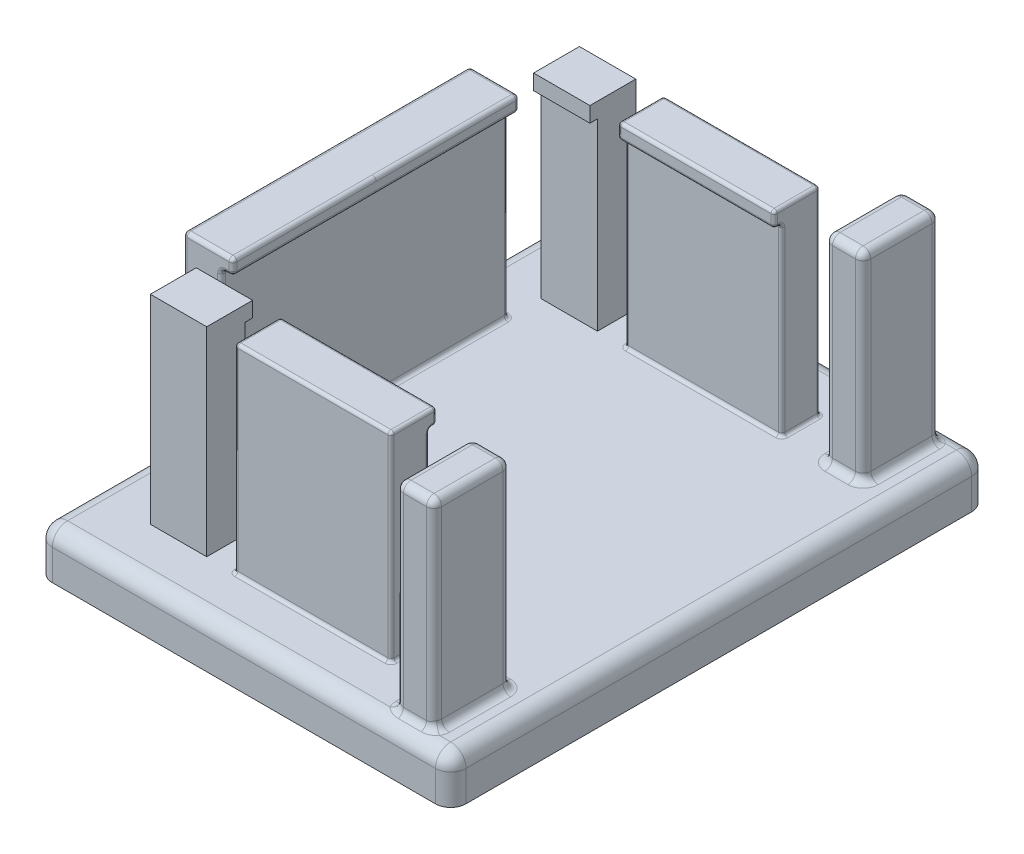
from build123d import *

# Parameters (mm, degrees)
SKETCH1_W              = 27
SKETCH1_H              = 35
BOSS_EXTRUDE1_DEPTH    = 3
FILLET1_R              = 1
FILLET2_R              = 1
FILLET3_R              = 1
FILLET4_R              = 1
SKETCH2_W              = 15.7
SKETCH2_H              = 2.5
BOSS_EXTRUDE5_DEPTH    = 13
SKETCH4_W              = 1.823720813
SKETCH4_H              = 2.5
CUT_EXTRUDE1_DEPTH     = 13
SKETCH2_7_W            = 2.5
SKETCH2_7_H            = 5
BOSS_EXTRUDE7_DEPTH    = 13
SKETCH2_8_W            = 2.5
SKETCH2_8_H            = 9.349999999
BOSS_EXTRUDE8_DEPTH    = 13
SKETCH9_W              = 9.349999999
SKETCH9_H              = 1
BOSS_EXTRUDE13_DEPTH   = 0.74200004
SKETCH8_W              = 10.2
SKETCH8_H              = 1
SKETCH8_W_2            = 3.676279187
BOSS_EXTRUDE12_DEPTH   = 0.492000032
FILLET64_R             = 0.5
FILLET65_R             = 0.2032
FILLET67_R             = 0.254
FILLET64_OF_MIRROR13_R = 0.5
FILLET65_OF_MIRROR13_R = 0.2032
FILLET67_OF_MIRROR13_R = 0.254


with BuildPart() as part:
    # Sketch1 → Boss-Extrude1 (new body)
    with BuildSketch(Plane(origin=(0, 0, 0), x_dir=(1, 0, 0), z_dir=(0, 1, 0))):
        with Locations((-49.521621622, -28.022046139)):
            Rectangle(SKETCH1_W, SKETCH1_H)
    extrude(amount=BOSS_EXTRUDE1_DEPTH)

    # Fillet1
    fillet1_edges = [part.edges().sort_by_distance(p)[0] for p in [
        (-36.021621622, 3, 28.022046139),
    ]]
    fillet(fillet1_edges, radius=FILLET1_R)

    # Fillet2
    fillet2_edges = [part.edges().sort_by_distance(p)[0] for p in [
        (-50.021621622, 3, 10.522046139),
        (-36.021621622, 1, 10.522046139),
        (-36.31451484, 2.707106781, 10.522046139),
        (-36.021621622, 1, 45.522046139),
        (-36.31451484, 2.707106781, 45.522046139),
        (-63.021621622, 3, 28.022046139),
        (-50.021621622, 3, 45.522046139),
    ]]
    fillet(fillet2_edges, radius=FILLET2_R)

    # Fillet3
    # the kernel refuses this fillet: 1 mm, written as the material it takes off along each edge
    with BuildSketch(Plane(origin=(-62.021621622, 2, 44.522046139), x_dir=(0, 0, 1), z_dir=(-1, 0, 0))) as fillet3_piece_1_section:
        Polygon((0, 0), (FILLET3_R, 0), (FILLET3_R, FILLET3_R), (0, FILLET3_R), align=None)
    fillet3_piece_1 = extrude(amount=FILLET3_R, mode=Mode.PRIVATE)
    fillet3_piece_1 = fillet3_piece_1 - Plane(origin=(-62.021621622, 2, 44.522046139), x_dir=(0, -0.7071067811865475, -0.7071067811865475), z_dir=(-1, 0, 0)) * Sphere(FILLET3_R, mode=Mode.PRIVATE)
    add(fillet3_piece_1, mode=Mode.SUBTRACT)
    with BuildSketch(Plane(origin=(-63.021621622, -2.5, 45.522046139), x_dir=(0, 0, -1), z_dir=(0, 1, 0))) as fillet3_piece_2:
        with BuildLine():
            CenterArc((FILLET3_R, -FILLET3_R), FILLET3_R, 90, 90)
            Line((0, -FILLET3_R), (0, 0))
            Line((0, 0), (FILLET3_R, 0))
        make_face()
    extrude(amount=4.5, mode=Mode.SUBTRACT)

    # Fillet4
    # the kernel refuses this fillet: 1 mm, written as the material it takes off along each edge
    with BuildSketch(Plane(origin=(-62.021621622, 2, 11.522046139), x_dir=(-1, 0, 0), z_dir=(0, 0, -1))) as fillet4_piece_1_section:
        Polygon((0, 0), (FILLET4_R, 0), (FILLET4_R, FILLET4_R), (0, FILLET4_R), align=None)
    fillet4_piece_1 = extrude(amount=FILLET4_R, mode=Mode.PRIVATE)
    fillet4_piece_1 = fillet4_piece_1 - Plane(origin=(-62.021621622, 2, 11.522046139), x_dir=(0.7071067811865475, -0.7071067811865475, 0), z_dir=(0, 0, -1)) * Sphere(FILLET4_R, mode=Mode.PRIVATE)
    add(fillet4_piece_1, mode=Mode.SUBTRACT)
    with BuildSketch(Plane(origin=(-63.021621622, -2.5, 10.522046139), x_dir=(1, 0, 0), z_dir=(0, 1, 0))) as fillet4_piece_2:
        with BuildLine():
            CenterArc((FILLET4_R, -FILLET4_R), FILLET4_R, 90, 90)
            Line((0, -FILLET4_R), (0, 0))
            Line((0, 0), (FILLET4_R, 0))
        make_face()
    extrude(amount=4.5, mode=Mode.SUBTRACT)

    # Sketch2 → Boss-Extrude5 (add)
    with BuildSketch(Plane(origin=(0, 3, 0), x_dir=(1, 0, 0), z_dir=(0, 1, 0))):
        with Locations((-51.271621622, -40.772046139)):
            Rectangle(SKETCH2_W, SKETCH2_H)
    boss_extrude5 = extrude(amount=BOSS_EXTRUDE5_DEPTH)

    # Sketch4 → Cut-Extrude1 (cut)
    with BuildSketch(Plane(origin=(0, 16, 0), x_dir=(1, 0, 0), z_dir=(0, 1, 0))):
        with Locations((-54.533482029, -40.772046139)):
            Rectangle(SKETCH4_W, SKETCH4_H)
    cut_extrude1 = extrude(amount=-CUT_EXTRUDE1_DEPTH, mode=Mode.SUBTRACT)

    # Sketch2<7> → Boss-Extrude7 (add)
    with BuildSketch(Plane(origin=(0, 3, 0), x_dir=(1, 0, 0), z_dir=(0, 1, 0))):
        with Locations((-39.358145337, -42.022046139)):
            Rectangle(SKETCH2_7_W, SKETCH2_7_H)
    boss_extrude7 = extrude(amount=BOSS_EXTRUDE7_DEPTH)

    # Sketch2<8> → Boss-Extrude8 (add)
    with BuildSketch(Plane(origin=(0, 3, 0), x_dir=(1, 0, 0), z_dir=(0, 1, 0))):
        with Locations((-60.371621622, -32.697046138)):
            Rectangle(SKETCH2_8_W, SKETCH2_8_H)
    boss_extrude8 = extrude(amount=BOSS_EXTRUDE8_DEPTH)

    # Sketch9 → Boss-Extrude13 (add)
    with BuildSketch(Plane(origin=(-59.121621622, 0, 0), x_dir=(0, 0, -1), z_dir=(1, 0, 0))):
        with Locations((-32.697046138, 15.5)):
            Rectangle(SKETCH9_W, SKETCH9_H)
    boss_extrude13 = extrude(amount=BOSS_EXTRUDE13_DEPTH)

    # Sketch8 → Boss-Extrude12 (add)
    with BuildSketch(Plane(origin=(0, 0, 39.522046139), x_dir=(-1, 0, 0), z_dir=(0, 0, -1))):
        with Locations((48.521621622, 15.5)):
            Rectangle(SKETCH8_W, SKETCH8_H)
        with Locations((57.283482029, 15.5)):
            Rectangle(SKETCH8_W_2, SKETCH8_H)
    boss_extrude12 = extrude(amount=BOSS_EXTRUDE12_DEPTH)

    # Fillet64
    fillet64_edges = [part.edges().sort_by_distance(p)[0] for p in [
        (-40.608145337, 9.5, 39.522046139),
        (-40.608145337, 9.5, 44.522046139),
        (-39.358145337, 16, 39.522046139),
        (-39.358145337, 16, 44.522046139),
        (-40.608145337, 16, 42.022046139),
        (-38.108145337, 9.5, 39.522046139),
        (-38.108145337, 9.5, 44.522046139),
        (-38.108145337, 16, 42.022046139),
    ]]
    fillet(fillet64_edges, radius=FILLET64_R)
    fillet64_2_edges = [part.edges().sort_by_distance(p)[0] for p in [
        (-39.358145337, 3, 39.522046139),
        (-40.608145337, 3, 42.022046139),
        (-39.358145337, 3, 44.522046139),
        (-38.108145337, 3, 42.022046139),
        (-38.254591947, 3, 39.668492748),
        (-38.254591947, 3, 44.375599529),
        (-40.461698728, 3, 44.375599529),
        (-40.461698728, 3, 39.668492748),
    ]]
    fillet(fillet64_2_edges, radius=FILLET64_R)

    # Fillet65
    fillet65_edges = [part.edges().sort_by_distance(p)[0] for p in [
        (-43.421621622, 9, 39.522046139),
        (-48.521621622, 15, 39.522046139),
        (-43.421621622, 15, 39.276046123),
        (-53.621621622, 15, 39.276046123),
        (-43.421621622, 15.5, 39.030046107),
        (-48.521621622, 15, 39.030046107),
        (-53.621621622, 15.5, 39.030046107),
        (-48.521621622, 16, 39.030046107),
        (-43.421621622, 16, 40.526046123),
        (-43.421621622, 9.5, 42.022046139),
        (-43.421621622, 3, 40.772046139),
        (-48.521621622, 16, 42.022046139),
        (-48.521621622, 3, 39.522046139),
        (-48.521621622, 3, 42.022046139),
        (-53.621621622, 3, 40.772046139),
        (-53.621621622, 9, 39.522046139),
        (-53.621621622, 9.5, 42.022046139),
        (-53.621621622, 16, 40.526046123),
    ]]
    fillet(fillet65_edges, radius=FILLET65_R)

    # Fillet67
    fillet67_edges = [part.edges().sort_by_distance(p)[0] for p in [
        (-60.000621602, 16, 37.372046138),
        (-61.621621622, 9.5, 37.372046138),
        (-59.121621622, 3, 32.697046138),
        (-61.621621622, 3, 32.697046138),
        (-61.621621622, 16, 32.697046138),
        (-60.371621622, 3, 37.372046138),
        (-59.121621622, 9, 37.372046138),
        (-59.121621622, 15, 32.697046138),
        (-58.750621602, 15, 37.372046138),
        (-58.379621582, 15.5, 37.372046138),
        (-58.379621582, 15, 32.697046138),
        (-58.379621582, 16, 32.697046138),
    ]]
    fillet(fillet67_edges, radius=FILLET67_R)

    # Mirror13: Boss-Extrude5, Cut-Extrude1, Boss-Extrude7, Boss-Extrude8, Boss-Extrude13, Boss-Extrude12 across plane
    add(boss_extrude5.mirror(Plane(origin=(0, 0, 28.022046139), x_dir=(1, 0, 0), z_dir=(0, 0, -1))))
    add(cut_extrude1.mirror(Plane(origin=(0, 0, 28.022046139), x_dir=(1, 0, 0), z_dir=(0, 0, -1))), mode=Mode.SUBTRACT)
    add(boss_extrude7.mirror(Plane(origin=(0, 0, 28.022046139), x_dir=(1, 0, 0), z_dir=(0, 0, -1))))
    add(boss_extrude8.mirror(Plane(origin=(0, 0, 28.022046139), x_dir=(1, 0, 0), z_dir=(0, 0, -1))))
    add(boss_extrude13.mirror(Plane(origin=(0, 0, 28.022046139), x_dir=(1, 0, 0), z_dir=(0, 0, -1))))
    add(boss_extrude12.mirror(Plane(origin=(0, 0, 28.022046139), x_dir=(1, 0, 0), z_dir=(0, 0, -1))))

    # Fillet64 of Mirror13
    fillet64_of_mirror13_edges = [part.edges().sort_by_distance(p)[0] for p in [
        (-40.608145337, 9.5, 16.522046139),
        (-40.608145337, 9.5, 11.522046139),
        (-39.358145337, 16, 16.522046139),
        (-39.358145337, 16, 11.522046139),
        (-40.608145337, 16, 14.022046139),
        (-38.108145337, 9.5, 16.522046139),
        (-38.108145337, 9.5, 11.522046139),
        (-38.108145337, 16, 14.022046139),
    ]]
    fillet(fillet64_of_mirror13_edges, radius=FILLET64_OF_MIRROR13_R)
    fillet64_of_mirror13_2_edges = [part.edges().sort_by_distance(p)[0] for p in [
        (-39.358145337, 3, 16.522046139),
        (-40.608145337, 3, 14.022046139),
        (-39.358145337, 3, 11.522046139),
        (-38.108145337, 3, 14.022046139),
        (-38.254591947, 3, 16.375599529),
        (-38.254591947, 3, 11.668492748),
        (-40.461698728, 3, 11.668492748),
        (-40.461698728, 3, 16.375599529),
    ]]
    fillet(fillet64_of_mirror13_2_edges, radius=FILLET64_OF_MIRROR13_R)

    # Fillet65 of Mirror13
    fillet65_of_mirror13_edges = [part.edges().sort_by_distance(p)[0] for p in [
        (-43.421621622, 9, 16.522046139),
        (-48.521621622, 15, 16.522046139),
        (-43.421621622, 15, 16.768046155),
        (-53.621621622, 15, 16.768046155),
        (-43.421621622, 15.5, 17.014046171),
        (-48.521621622, 15, 17.014046171),
        (-53.621621622, 15.5, 17.014046171),
        (-48.521621622, 16, 17.014046171),
        (-43.421621622, 16, 15.518046155),
        (-43.421621622, 9.5, 14.022046139),
        (-43.421621622, 3, 15.272046139),
        (-48.521621622, 16, 14.022046139),
        (-48.521621622, 3, 16.522046139),
        (-48.521621622, 3, 14.022046139),
        (-53.621621622, 3, 15.272046139),
        (-53.621621622, 9, 16.522046139),
        (-53.621621622, 9.5, 14.022046139),
        (-53.621621622, 16, 15.518046155),
    ]]
    fillet(fillet65_of_mirror13_edges, radius=FILLET65_OF_MIRROR13_R)

    # Fillet67 of Mirror13
    fillet67_of_mirror13_edges = [part.edges().sort_by_distance(p)[0] for p in [
        (-60.000621602, 16, 18.67204614),
        (-61.621621622, 9.5, 18.67204614),
        (-59.121621622, 3, 23.347046139),
        (-61.621621622, 3, 23.347046139),
        (-61.621621622, 16, 23.347046139),
        (-60.371621622, 3, 18.67204614),
        (-59.121621622, 9, 18.67204614),
        (-59.121621622, 15, 23.347046139),
        (-58.750621602, 15, 18.67204614),
        (-58.379621582, 15.5, 18.67204614),
        (-58.379621582, 15, 23.347046139),
        (-58.379621582, 16, 23.347046139),
    ]]
    fillet(fillet67_of_mirror13_edges, radius=FILLET67_OF_MIRROR13_R)


solid = part.part
